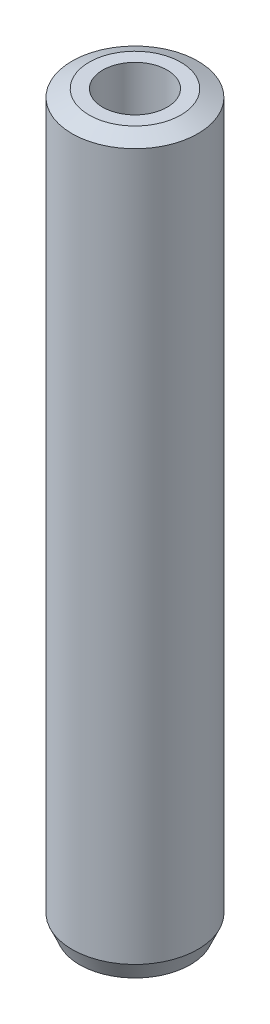
from build123d import *
from OCP.BRepFilletAPI import BRepFilletAPI_MakeChamfer

# Parameters (mm, degrees)
SKETCH1_R           = 17.5
BOSS_EXTRUDE1_DEPTH = 203.344943854
SKETCH2_R           = 8.965338831
CUT_EXTRUDE1_DEPTH  = 205.845469052
CHAMFER1_SIZE       = 2.105064963
CHAMFER1_SIZE2      = 4.755493554


with BuildPart() as part:
    # Sketch1 → Boss-Extrude1 (new body)
    with BuildSketch(Plane(origin=(0, 0, 0), x_dir=(1, 0, 0), z_dir=(0, 1, 0))):
        Circle(SKETCH1_R)
    extrude(amount=BOSS_EXTRUDE1_DEPTH)

    # Sketch2 → Cut-Extrude1 (cut, through all)
    with BuildSketch(Plane(origin=(0, 0, 0), x_dir=(1, 0, 0), z_dir=(0, 1, 0))):
        Circle(SKETCH2_R)
    extrude(amount=CUT_EXTRUDE1_DEPTH, mode=Mode.SUBTRACT)

    # Chamfer1: one chamfer whose edges measure the first distance from different faces: ONE call of the kernel's chamfer builder (chamfer() names one face for all edges)
    chamfer1_edges_1 = [part.edges().sort_by_distance(p)[0] for p in [
        (-17.5, 203.344943854, 0),
    ]]
    chamfer1_side_1 = [part.faces().sort_by_distance(p)[0] for p in [
        (-17.5, 101.672471927, 0),
    ]]
    chamfer1_edges_2 = [part.edges().sort_by_distance(p)[0] for p in [
        (-17.5, 0, 0),
    ]]
    chamfer1_side_2 = [part.faces().sort_by_distance(p)[0] for p in [
        (-17.005025253, 0, 0),
    ]]
    chamfer1 = BRepFilletAPI_MakeChamfer(part.part.solid().wrapped)
    for e in chamfer1_edges_1:
        chamfer1.Add(CHAMFER1_SIZE, CHAMFER1_SIZE2, e.wrapped, chamfer1_side_1[0].wrapped)  # the first distance lies on this face
    for e in chamfer1_edges_2:
        chamfer1.Add(CHAMFER1_SIZE, CHAMFER1_SIZE2, e.wrapped, chamfer1_side_2[0].wrapped)  # the first distance lies on this face
    add(Compound.cast(chamfer1.Shape()), mode=Mode.REPLACE)


solid = part.part
